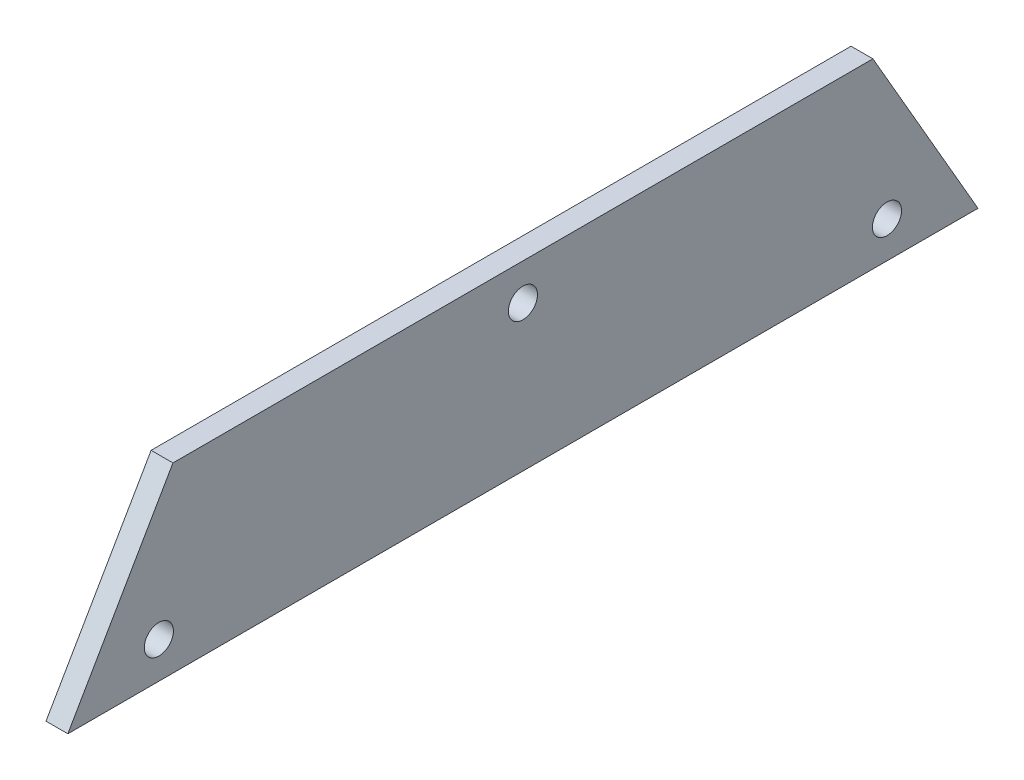
from build123d import *

# Parameters (mm, degrees)
SKETCH1_W          = 300
SKETCH1_H          = 50
SKETCH1_R          = 4
EXTRUDE1_DEPTH     = 6
CUT_EXTRUDE1_REACH = 154.187


with BuildPart() as part:
    # Sketch1 → Extrude1 (new body)
    with BuildSketch(Plane(origin=(0, 0, 0), x_dir=(0, 0, -1), z_dir=(1, 0, 0))):
        Rectangle(SKETCH1_W, SKETCH1_H)
        with Locations((0, 15)):
            Circle(SKETCH1_R, mode=Mode.SUBTRACT)
        with Locations((-100, -15)):
            Circle(SKETCH1_R, mode=Mode.SUBTRACT)
        with Locations((100, -15)):
            Circle(SKETCH1_R, mode=Mode.SUBTRACT)
    extrude(amount=EXTRUDE1_DEPTH)

    # Sketch2 → Cut-Extrude1 (cut, up to next)
    with BuildSketch(Plane(origin=(6, 0, 0), x_dir=(0, 0, -1), z_dir=(1, 0, 0)), mode=Mode.PRIVATE) as cut_extrude1_sk1:
        Polygon((-150, 25), (-150, -25), (-125, -25), (-96.132486541, 25), align=None)
    cut_extrude1_tool1 = extrude(cut_extrude1_sk1.sketch, amount=-CUT_EXTRUDE1_REACH, mode=Mode.PRIVATE) & part.part
    # Sketch2 → Cut-Extrude1 (cut, up to next)
    with BuildSketch(Plane(origin=(6, 0, 0), x_dir=(0, 0, -1), z_dir=(1, 0, 0)), mode=Mode.PRIVATE) as cut_extrude1_sk2:
        Polygon((96.132486541, 25), (150, 25), (150, -25), (125, -25), align=None)
    cut_extrude1_tool2 = extrude(cut_extrude1_sk2.sketch, amount=-CUT_EXTRUDE1_REACH, mode=Mode.PRIVATE) & part.part
    add(cut_extrude1_tool1.solids().sort_by_distance((6, 3.050212, 129.402601))[0], mode=Mode.SUBTRACT)
    add(cut_extrude1_tool2.solids().sort_by_distance((6, 3.050212, -129.402601))[0], mode=Mode.SUBTRACT)


solid = part.part
